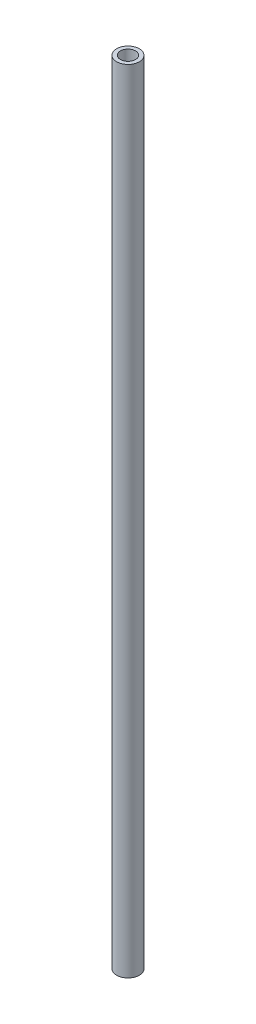
from build123d import *

# Parameters (mm, degrees)
SKETCH1_R           = 3.81
SKETCH1_R_2         = 2.54
BOSS_EXTRUDE1_DEPTH = 266.7


with BuildPart() as part:
    # Sketch1 → Boss-Extrude1 (new body)
    with BuildSketch(Plane(origin=(0, 0, 0), x_dir=(1, 0, 0), z_dir=(0, 1, 0))):
        Circle(SKETCH1_R)
        Circle(SKETCH1_R_2, mode=Mode.SUBTRACT)
    extrude(amount=BOSS_EXTRUDE1_DEPTH)


solid = part.part
